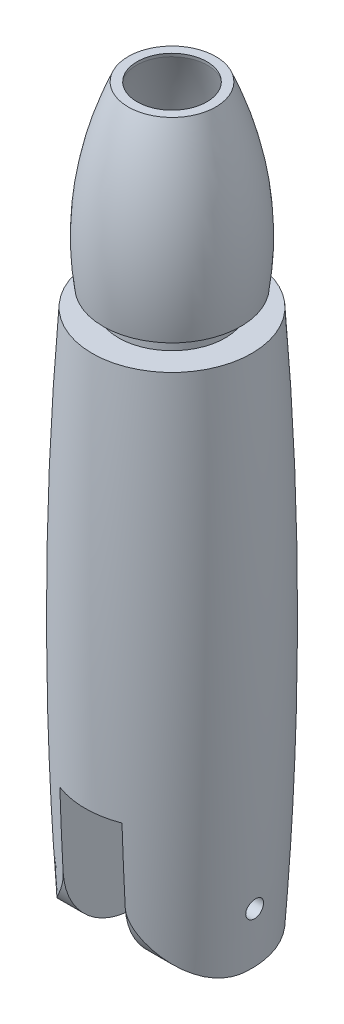
from build123d import *

# Parameters (mm, degrees)
CUT_EXTRUDE1_DEPTH      = 85.764379442
CUT_EXTRUDE1_DEPTH_BACK = 7.5
SKETCH2_W               = 7
SKETCH2_H               = 16
CUT_EXTRUDE2_DEPTH      = 85.764379442
CUT_EXTRUDE2_DEPTH_BACK = 85.764379442
SKETCH3_R               = 1
CUT_EXTRUDE4_REACH      = 76.985
SKETCH5_R               = 0.5
SKETCH6_W               = 7
SKETCH6_H               = 6
CUT_EXTRUDE5_DEPTH      = 86.972379423


with BuildPart() as part:
    # Sketch1 → Revolve1 (revolve)
    with BuildSketch(Plane.XY):
        with BuildLine():
            Line((3, 60), (0, 60))
            ThreePointArc((0, 60), (-1, 30), (0, 0))
            Line((0, 0), (3, 0))
            Line((3, 0), (9, 0))
            Line((9, 0), (9, 14))
            Line((9, 14), (9, 26))
            Line((9, 26), (9, 60))
            Line((9, 60), (9, 71.845749874))
            Line((9, 71.845749874), (2.237118871, 71.845749874))
            add(Edge.make_bspline(
                [(4.990117088, 81.608356612), (4.650560747, 80.810611516), (4.014791389, 79.180712417), (3.110824263, 76.339058983), (2.550981979, 73.890897473), (2.293586976, 72.251014058), (2.237118871, 71.845749874)],
                knots=[0, 0, 0, 0, 0.125, 0.25, 0.440447326, 0.502947326, 0.502947326, 0.502947326, 0.502947326], degree=3))
            Line((4.990117088, 81.608356612), (5.07, 82))
            Line((5.07, 82), (4.07, 82))
            add(Edge.make_bspline(
                [(4.07, 82), (-0.150100512, 72.085402408), (1.25, 62)],
                knots=[0, 0, 0, 1, 1, 1], degree=2))
            Line((1.25, 62), (3, 62))
            Line((3, 62), (3, 60))
        make_face()
    revolve(axis=Axis((9, 26, 0), (0, -1, 0)))

    # Sketch2 → Cut-Extrude1 (cut, two sides: drawn at the far end of the back side and taken through both)
    with BuildSketch(Plane.XY.offset(-CUT_EXTRUDE1_DEPTH_BACK)):
        with Locations((9, 8)):
            Rectangle(SKETCH2_W, SKETCH2_H)
    extrude(amount=CUT_EXTRUDE1_DEPTH + CUT_EXTRUDE1_DEPTH_BACK, mode=Mode.SUBTRACT)

    # Sketch3 → Cut-Extrude2 (cut, two sides: drawn at the far end of the back side and taken through both)
    with BuildSketch(Plane(origin=(0, 0, 0), x_dir=(0, 0, -1), z_dir=(1, 0, 0)).offset(-CUT_EXTRUDE2_DEPTH_BACK)):
        with BuildLine():
            add(Edge.make_bspline(
                [(-8.291561976, 0), (-8.387241949, 1.320758234), (-8.476359043, 2.64194982), (-8.600349068, 4.624376749), (-8.659921887, 5.615750152), (-8.715884867, 6.607361916), (-8.745670836, 7.14674895), (-8.757214955, 7.358763953), (-8.768618221, 7.571211202)],
                knots=[0, 0, 0, 0, 0.25, 0.25, 0.375, 0.4375, 0.4375, 0.476982441, 0.476982441, 0.476982441, 0.476982441], degree=3))
            Line((-8.291561976, 0), (-0.780117726, 0))
            ThreePointArc((-0.780117726, 0), (-6.283284524, 2.193524719), (-8.768618221, 7.571211202))
        make_face()
        with Locations((0, 6)):
            Circle(SKETCH3_R)
    extrude(amount=CUT_EXTRUDE2_DEPTH + CUT_EXTRUDE2_DEPTH_BACK, mode=Mode.SUBTRACT)

    # Sketch5 → Cut-Extrude4 (cut, up to next)
    with BuildSketch(Plane(origin=(0, 71.845749874, 0), x_dir=(1, 0, 0), z_dir=(0, 1, 0)), mode=Mode.PRIVATE) as cut_extrude4_sk1:
        with Locations((9, 4)):
            Circle(SKETCH5_R)
    cut_extrude4_tool1 = extrude(cut_extrude4_sk1.sketch, amount=-CUT_EXTRUDE4_REACH, mode=Mode.PRIVATE) & part.part
    # Sketch5 → Cut-Extrude4 (cut, up to next)
    with BuildSketch(Plane(origin=(0, 71.845749874, 0), x_dir=(1, 0, 0), z_dir=(0, 1, 0)), mode=Mode.PRIVATE) as cut_extrude4_sk2:
        with Locations((9, -3)):
            Circle(SKETCH5_R)
    cut_extrude4_tool2 = extrude(cut_extrude4_sk2.sketch, amount=-CUT_EXTRUDE4_REACH, mode=Mode.PRIVATE) & part.part
    add(cut_extrude4_tool1.solids().sort_by_distance((9, 71.84575, -4))[0], mode=Mode.SUBTRACT)
    add(cut_extrude4_tool2.solids().sort_by_distance((9, 71.84575, 3))[0], mode=Mode.SUBTRACT)

    # Sketch6 → Cut-Extrude5 (cut, through all)
    with BuildSketch(Plane.XY.offset(-7.5)):
        with Locations((9, 3)):
            Rectangle(SKETCH6_W, SKETCH6_H)
    extrude(amount=-CUT_EXTRUDE5_DEPTH, mode=Mode.SUBTRACT)


solid = part.part
